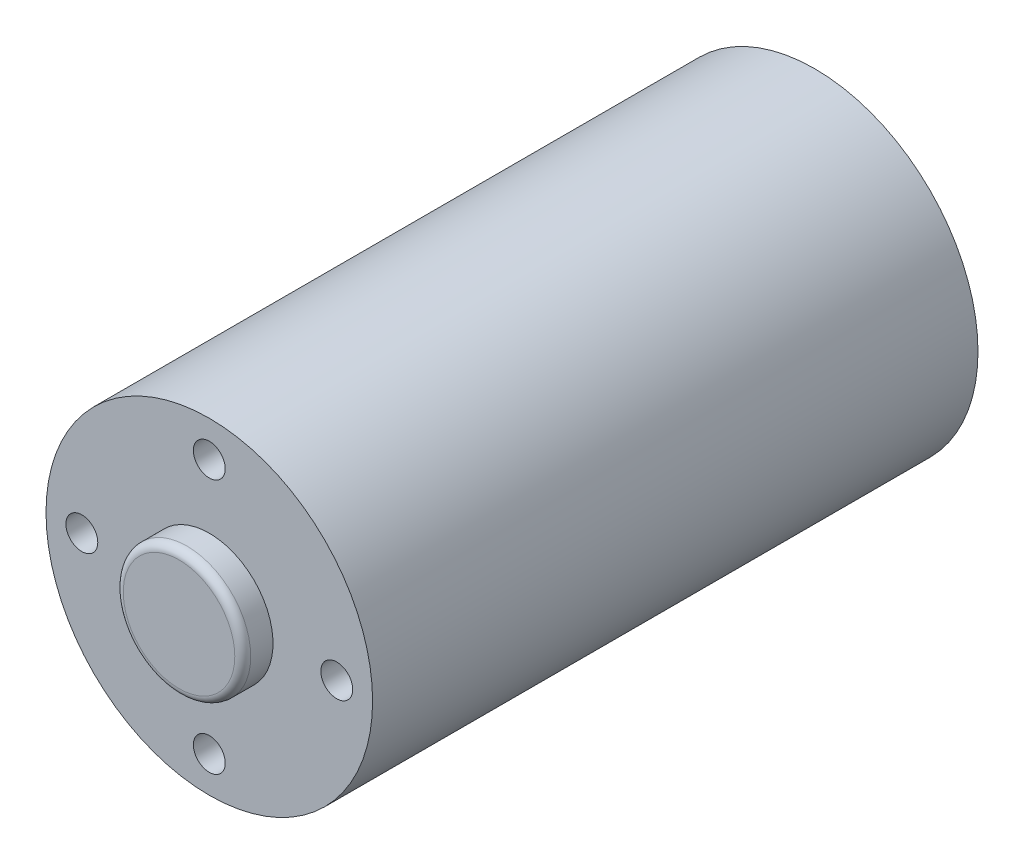
from build123d import *

# Parameters (mm, degrees)
BOSS_EXTRUDE1_DEPTH      = 19
BOSS_EXTRUDE1_DEPTH_BACK = 19
SKETCH1_R                = 10.25
SKETCH2_R                = 4
BOSS_EXTRUDE2_DEPTH      = 1.9
BOSS_EXTRUDE3_START      = 1
SKETCH3_R                = 4
BOSS_EXTRUDE3_DEPTH      = 1
SKETCH4_R                = 1
CUT_EXTRUDE1_DEPTH       = 3.5
FILLET1_R                = 0.5


with BuildPart() as part:
    # Sketch1 → Boss-Extrude1 (new, two sides: drawn at the far end of the back side and taken through both)
    with BuildSketch(Plane.XY.offset(-BOSS_EXTRUDE1_DEPTH_BACK)):
        Circle(SKETCH1_R)
    extrude(amount=BOSS_EXTRUDE1_DEPTH + BOSS_EXTRUDE1_DEPTH_BACK)

    # Sketch2 → Boss-Extrude2 (add)
    with BuildSketch(Plane.XY.offset(19)):
        Circle(SKETCH2_R)
    extrude(amount=BOSS_EXTRUDE2_DEPTH)

    # Sketch3 → Boss-Extrude3 (add)
    with BuildSketch(Plane(origin=(0, 0, -19), x_dir=(-1, 0, 0), z_dir=(0, 0, -1)).offset(BOSS_EXTRUDE3_START)):
        Circle(SKETCH3_R)
    extrude(amount=-BOSS_EXTRUDE3_DEPTH)

    # Sketch4 → Cut-Extrude1 (cut)
    with BuildSketch(Plane.XY.offset(19)):
        with Locations((8, 0)):
            Circle(SKETCH4_R)
        with Locations((0, 8)):
            Circle(SKETCH4_R)
        with Locations((0, -8)):
            Circle(SKETCH4_R)
        with Locations((-8, 0)):
            Circle(SKETCH4_R)
    cut_extrude1 = extrude(amount=-CUT_EXTRUDE1_DEPTH, mode=Mode.SUBTRACT)

    # Fillet1
    fillet1_edges = [part.edges().sort_by_distance(p)[0] for p in [
        (-4, 0, 20.9),
    ]]
    fillet(fillet1_edges, radius=FILLET1_R)

    # Mirror1: Cut-Extrude1 across plane
    add(cut_extrude1.mirror(Plane(origin=(0, 0, 0), x_dir=(1, 0, 0), z_dir=(0, 0, -1))), mode=Mode.SUBTRACT)


solid = part.part
